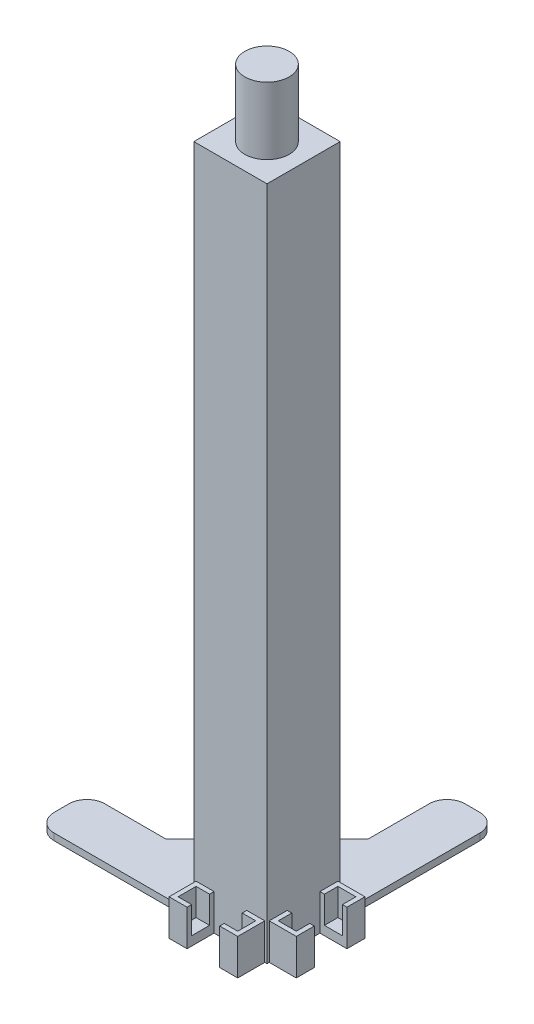
from build123d import *
from build123d.topology import SkipClean

# Parameters (mm, degrees)
SKETCH1_W                = 30
SKETCH1_H                = 30
BOSS_EXTRUDE1_DEPTH      = 80
SKETCH2_R                = 6
BOSS_EXTRUDE2_DEPTH      = 22
CUT_EXTRUDE1_DEPTH       = 83.764726786
BOSS_EXTRUDE3_DEPTH      = 100
BOSS_EXTRUDE5_DEPTH      = 2
BOSS_EXTRUDE6_DEPTH      = 23
BOSS_EXTRUDE7_DEPTH      = 25
FILLET1_R                = 2
SKETCH11_R               = 6.055782361
CUT_EXTRUDE2_DEPTH       = 2.125
SKETCH12_W               = 13.25
SKETCH12_H               = 8.5
CUT_EXTRUDE4_DEPTH       = 13.25
CUT_EXTRUDE5_REACH       = 204.341
SKETCH15_W               = 3.75
SKETCH15_H               = 3.75
FILLET2_R                = 1
CUT_EXTRUDE7_START       = 22
SKETCH16_R               = 6
CUT_EXTRUDE7_DEPTH       = 22
SKETCH17_R               = 15
BOSS_EXTRUDE8_DEPTH      = 40
FILLET3_R                = 1
SKETCH18_R               = 15
SKETCH18_R_2             = 7.5
BOSS_EXTRUDE9_DEPTH      = 2
SKETCH22_R               = 209.016423622
CUT_EXTRUDE8_DEPTH       = 225.815151847
SKETCH23_W               = 22.070362909
SKETCH23_H               = 16.212180161
CUT_EXTRUDE9_DEPTH       = 65.514197169
SKETCH24_R               = 15
BOSS_EXTRUDE10_DEPTH     = 40
SKETCH25_R               = 15
SKETCH25_R_2             = 7.5
BOSS_EXTRUDE11_DEPTH     = 2
BOSS_EXTRUDE12_DEPTH     = 40
SKETCH29_R               = 2
CUT_EXTRUDE10_DEPTH      = 209.128716183
SKETCH30_R               = 3.025
CUT_EXTRUDE11_DEPTH      = 2.1
CUT_EXTRUDE12_DEPTH      = 111.386253673
CUT_EXTRUDE12_DEPTH_BACK = 111.386253673
SKETCH31_W               = 80
SKETCH31_H               = 80
BOSS_EXTRUDE13_DEPTH     = 190
CUT_EXTRUDE13_DEPTH      = 191.213565988
CUT_EXTRUDE13_DEPTH_BACK = 191.213565988
SKETCH33_W               = 105.751798623
SKETCH33_H               = 51.18837061
SKETCH34_R               = 4.925
BOSS_EXTRUDE14_DEPTH     = 14.9
SKETCH35_W               = 6
SKETCH35_H               = 4
SKETCH35_W_2             = 4
SKETCH35_H_2             = 6
BOSS_EXTRUDE15_DEPTH     = 8
SKETCH36_W               = 13.25
SKETCH36_H               = 4
SKETCH36_W_2             = 4
SKETCH36_H_2             = 13.25
CUT_EXTRUDE14_DEPTH      = 6
BOSS_EXTRUDE16_DEPTH     = 1.5
FILLET4_R                = 4


with BuildPart() as part:
    # Sketch1 → Boss-Extrude1 (new body)
    with BuildSketch(Plane(origin=(0, 0, 0), x_dir=(1, 0, 0), z_dir=(0, 1, 0))):
        Rectangle(SKETCH1_W, SKETCH1_H)
    extrude(amount=BOSS_EXTRUDE1_DEPTH)

    # Sketch2 → Boss-Extrude2 (add)
    with BuildSketch(Plane(origin=(0, 80, 0), x_dir=(1, 0, 0), z_dir=(0, 1, 0))):
        with Locations(Location((9, -9, 0), (0, 0, 270))):
            Circle(SKETCH2_R)
    extrude(amount=BOSS_EXTRUDE2_DEPTH)

    # Sketch3 → Cut-Extrude1 (cut, through all)
    with BuildSketch(Plane(origin=(0, 80, 0), x_dir=(1, 0, 0), z_dir=(0, 1, 0))):
        with BuildLine():
            Line((9, -15), (15, -15))
            Line((15, -15), (15, -9))
            ThreePointArc((15, -9), (13.242640687, -13.242640687), (9, -15))
        make_face()
    extrude(amount=-CUT_EXTRUDE1_DEPTH, mode=Mode.SUBTRACT)

    # Sketch4 → Boss-Extrude3 (add)
    with BuildSketch(Plane(origin=(0, 80, 0), x_dir=(1, 0, 0), z_dir=(0, 1, 0))):
        Polygon((-8.25, 11.25), (-8.25, 8.25), (-11.25, 8.25), (-15, 8.25), (-15, 11.25), (-11.25, 11.25), (-11.25, 15), (-8.25, 15), align=None)
        Polygon((-1.75, 1.75), (-11.25, 1.75), (-15, 1.75), (-15, -1.25), (-11.25, -1.25), (1.25, -1.25), (1.25, 11.25), (1.25, 15), (-1.75, 15), (-1.75, 11.25), align=None)
    extrude(amount=BOSS_EXTRUDE3_DEPTH)

    # Sketch6 → Boss-Extrude5 (add)
    with BuildSketch(Plane.XZ):
        with BuildLine():
            Line((15, -15), (7, -15))
            Line((7, -15), (7, -99.5))
            ThreePointArc((7, -99.5), (2.757359313, -109.742640687), (13, -105.5))
            Line((13, -105.5), (15, -105.5))
            Line((15, -105.5), (15, -15))
        make_face()
    extrude(amount=-BOSS_EXTRUDE5_DEPTH)

    # Sketch7 → Boss-Extrude6 (add)
    with SkipClean():  # the faces are left unmerged after this step: merging them gives an invalid solid
        with BuildSketch(Plane(origin=(0, 2, 0), x_dir=(1, 0, 0), z_dir=(0, 1, 0))):
            with BuildLine():
                Line((9, 111.156854249), (9, 108.964101615))
                ThreePointArc((9, 108.964101615), (7, 101.5), (5, 108.964101615))
                Line((5, 108.964101615), (5, 111.156854249))
                ThreePointArc((5, 111.156854249), (1.086408642, 104.485388128), (7, 99.5))
                Line((7, 99.5), (7, 15))
                Line((7, 15), (15, 15))
                Line((15, 15), (15, 105.5))
                Line((15, 105.5), (13, 105.5))
                ThreePointArc((13, 105.5), (11.898979486, 108.964101615), (9, 111.156854249))
            make_face()
        extrude(amount=BOSS_EXTRUDE6_DEPTH)

    # Sketch9 → Boss-Extrude7 (add)
    with SkipClean():  # the faces are left unmerged after this step: merging them gives an invalid solid
        with BuildSketch(Plane.XZ):
            with BuildLine():
                Line((-15, 15), (-15, 7))
                Line((-15, 7), (-126.175, 7))
                ThreePointArc((-126.175, 7), (-126.252697751, 6.037536458), (-126.48377869, 5.1))
                Line((-126.48377869, 5.1), (-128.797778509, 5.1))
                ThreePointArc((-128.797778509, 5.1), (-136.05, 7), (-128.797778509, 8.9))
                Line((-128.797778509, 8.9), (-126.3, 8.9))
                ThreePointArc((-126.3, 8.9), (-128.491885554, 11.955834237), (-132.050001601, 13.173329766))
                Line((-132.050001601, 13.173329766), (-132.050001601, 15))
                Line((-132.050001601, 15), (-15, 15))
            make_face()
        extrude(amount=-BOSS_EXTRUDE7_DEPTH)

    # Fillet1
    fillet1_edges = [part.edges().sort_by_distance(p)[0] for p in [
        (-126.175, 12.5, 7),
    ]]
    fillet(fillet1_edges, radius=FILLET1_R)

    # Sketch11 → Cut-Extrude2 (cut)
    with SkipClean():  # the faces are left unmerged after this step: merging them gives an invalid solid
        with BuildSketch(Plane.XZ):
            with Locations((-132.175, 7)):
                Circle(SKETCH11_R)
        extrude(amount=-CUT_EXTRUDE2_DEPTH, mode=Mode.SUBTRACT)

    # Sketch12 → Cut-Extrude4 (cut)
    with SkipClean():  # the faces are left unmerged after this step: merging them gives an invalid solid
        with BuildSketch(Plane.ZY.offset(15)):
            with Locations((-8.375, 72.75)):
                Rectangle(SKETCH12_W, SKETCH12_H)
        extrude(amount=-CUT_EXTRUDE4_DEPTH, mode=Mode.SUBTRACT)

    # Sketch15 → Cut-Extrude5 (cut, up to next)
    with BuildSketch(Plane(origin=(0, 80, 0), x_dir=(1, 0, 0), z_dir=(0, 1, 0)), mode=Mode.PRIVATE) as cut_extrude5_sk1:
        with Locations((-13.125, 13.125)):
            Rectangle(SKETCH15_W, SKETCH15_H)
    cut_extrude5_tool1 = extrude(cut_extrude5_sk1.sketch, amount=-CUT_EXTRUDE5_REACH, mode=Mode.PRIVATE) & part.part
    add(cut_extrude5_tool1.solids().sort_by_distance((-13.125, 80, -13.125))[0], mode=Mode.SUBTRACT)

    # Fillet2
    fillet2_edges = [part.edges().sort_by_distance(p)[0] for p in [
        (-11.25, 130, -15),
        (-11.25, 130, -11.25),
        (-15, 130, -11.25),
        (-15, 130, 1.25),
        (1.25, 130, -15),
    ]]
    fillet(fillet2_edges, radius=FILLET2_R)

    # Sketch16 → Cut-Extrude7 (cut)
    with SkipClean():  # the faces are left unmerged after this step: merging them gives an invalid solid
        with BuildSketch(Plane(origin=(0, 80, 0), x_dir=(1, 0, 0), z_dir=(0, 1, 0)).offset(CUT_EXTRUDE7_START)):
            with Locations((9, -9)):
                Circle(SKETCH16_R)
        extrude(amount=-CUT_EXTRUDE7_DEPTH, mode=Mode.SUBTRACT)


with BuildPart() as cut_extrude7_kept_piece:
    # of the separate pieces the step leaves, the one the design keeps (cut_extrude7_pieces_kept)
    add(part.part.solids().sort_by_distance((-15, 80, 0.25))[0])

    # Sketch17 → Boss-Extrude8 (add)
    with SkipClean():  # the faces are left unmerged after this step: merging them gives an invalid solid
        with BuildSketch(Plane(origin=(0, 180, 0), x_dir=(1, 0, 0), z_dir=(0, 1, 0))):
            with BuildLine():
                Line((-14, -1.25), (-14, -4.216394713))
                ThreePointArc((-14, -4.216394713), (-14.384018227, -33.129332993), (11.657578086, -20.561885701))
                ThreePointArc((11.657578086, -20.561885701), (14.532144442, -14.532144442), (20.561885701, -11.657578086))
                ThreePointArc((20.561885701, -11.657578086), (33.129332993, 14.384018227), (4.216394713, 14))
                Line((4.216394713, 14), (1.25, 14))
                Line((1.25, 14), (1.25, -1.25))
                Line((1.25, -1.25), (-14, -1.25))
            make_face()
            with Locations(Location((18.79163056, 5.25, 0), (0, 0, 270))):
                Circle(SKETCH17_R, mode=Mode.SUBTRACT)
            with Locations(Location((-5.25, -18.79163056, 0), (0, 0, 270))):
                Circle(SKETCH17_R, mode=Mode.SUBTRACT)
        extrude(amount=-BOSS_EXTRUDE8_DEPTH)

    # Fillet3
    # the kernel refuses this fillet: 1 mm, written as the material it adds along each edge
    with BuildSketch(Plane(origin=(-14, 140, 1.25), x_dir=(-0.9659258262890684, 0, -0.25881904510252046), z_dir=(0, 1, 0))) as fillet3_piece_1:
        with BuildLine():
            CenterArc((0.776457135, 0.965925826), FILLET3_R, 195, 60)
            Line((-0.189468691, 0.707106781), (0, 0))
            ThreePointArc((0, 0), (0.258819045, 0.034074174), (0.51763809, 0))
        make_face()
    extrude(amount=40)
    with BuildSketch(Plane(origin=(-14, 180, 4.216394713), x_dir=(0, 0, -1), z_dir=(0, -1, 0))) as fillet3_piece_2:
        with BuildLine():
            CenterArc((0.555444904, -1), FILLET3_R, 90, 57.202831704)
            ThreePointArc((-0.285148471, -0.458333333), (-0.140754957, -0.230298516), (0, 0))
            Line((0, 0), (0.555444904, 0))
        make_face()
    extrude(amount=40)
    with BuildSketch(Plane(origin=(1.25, 140, -14), x_dir=(-0.2588190451025201, 0, -0.9659258262890685), z_dir=(0, 1, 0))) as fillet3_piece_3:
        with BuildLine():
            CenterArc((0.776457135, -0.965925826), FILLET3_R, 105, 60)
            Line((-0.189468691, -0.707106781), (0, 0))
            ThreePointArc((0, 0), (0.258819045, -0.034074174), (0.51763809, 0))
        make_face()
    extrude(amount=40)
    with BuildSketch(Plane(origin=(4.216394713, 180, -14), x_dir=(-1, 0, 0), z_dir=(0, -1, 0))) as fillet3_piece_4:
        with BuildLine():
            CenterArc((0.555444904, 1), FILLET3_R, 212.797168296, 57.202831704)
            ThreePointArc((-0.285148471, 0.458333333), (-0.140754957, 0.230298516), (0, 0))
            Line((0, 0), (0.555444904, 0))
        make_face()
    extrude(amount=40)

    # Sketch18 → Boss-Extrude9 (add)
    with SkipClean():  # the faces are left unmerged after this step: merging them gives an invalid solid
        with BuildSketch(Plane.XZ.offset(-140)):
            with Locations(Location((-5.25, 18.79163056, 0), (0, 0, 90))):
                Circle(SKETCH18_R)
            with Locations(Location((-5.25, 18.79163056, 0), (0, 0, 270))):
                Circle(SKETCH18_R_2, mode=Mode.SUBTRACT)
        boss_extrude9 = extrude(amount=-BOSS_EXTRUDE9_DEPTH)

    # Sketch21 → Revolve1 (revolve)
    with SkipClean():  # the faces are left unmerged after this step: merging them gives an invalid solid
        with BuildSketch(Plane(origin=(-5.25, 0, 0), x_dir=(0, 0, -1), z_dir=(-1, 0, 0)), mode=Mode.PRIVATE) as revolve1_sk:
            Polygon((-11.29163056, -142), (-3.79163056, -154.5), (-3.79163056, -142), align=None)
        revolve1 = revolve(revolve1_sk.sketch.rotate(Axis((-5.25, 1065, 18.79163056), (0, -1, 0)), 180), axis=Axis((-5.25, 1065, 18.79163056), (0, -1, 0)))

    # Mirror1: Boss-Extrude9, Revolve1 across plane
    with SkipClean():  # the faces are left unmerged after this step: merging them gives an invalid solid
        add(boss_extrude9.mirror(Plane(origin=(0, 0, 0), x_dir=(0.7071067811865478, 0, 0.7071067811865472), z_dir=(0.7071067811865475, 0, -0.7071067811865477))))
        add(revolve1.mirror(Plane(origin=(0, 0, 0), x_dir=(0.7071067811865478, 0, 0.7071067811865472), z_dir=(0.7071067811865475, 0, -0.7071067811865477))))

    # Sketch22 → Cut-Extrude8 (cut, through all)
    with BuildSketch(Plane.XZ.offset(-140)):
        Circle(SKETCH22_R)
    extrude(amount=CUT_EXTRUDE8_DEPTH, mode=Mode.SUBTRACT)


with BuildPart() as cut_extrude8_piece_1:
    # of the separate pieces the step leaves, piece 1, a body of its own (cut_extrude8_pieces)
    add(cut_extrude7_kept_piece.part.solids().sort_by_distance((4.501543184, 180, -14.458333333))[0])

    # Sketch24 → Boss-Extrude10 (add)
    with BuildSketch(Plane(origin=(0, 180, 0), x_dir=(1, 0, 0), z_dir=(0, 1, 0))):
        with BuildLine():
            ThreePointArc((13.834213525, -37.57835306), (39.612293374, -39.612293374), (37.57835306, -13.834213525))
            ThreePointArc((37.57835306, -13.834213525), (33.79372713, -8.329895406), (34.31915027, -1.67070312))
            ThreePointArc((34.31915027, -1.67070312), (28.778505526, -8.507264569), (20.561885701, -11.657578086))
            ThreePointArc((20.561885701, -11.657578086), (14.532144442, -14.532144442), (11.657578086, -20.561885701))
            ThreePointArc((11.657578086, -20.561885701), (8.507264569, -28.778505526), (1.67070312, -34.31915027))
            ThreePointArc((1.67070312, -34.31915027), (8.329895406, -33.79372713), (13.834213525, -37.57835306))
        make_face()
        with Locations(Location((27.591478094, -27.591478094, 0), (0, 0, 270))):
            Circle(SKETCH24_R, mode=Mode.SUBTRACT)
    extrude(amount=-BOSS_EXTRUDE10_DEPTH)

    # Sketch25 → Boss-Extrude11 (add)
    with BuildSketch(Plane.XZ.offset(-140)):
        with Locations(Location((27.591478094, 27.591478094, 0), (0, 0, 90))):
            Circle(SKETCH25_R)
        with Locations(Location((27.591478094, 27.591478094, 0), (0, 0, 270))):
            Circle(SKETCH25_R_2, mode=Mode.SUBTRACT)
    extrude(amount=-BOSS_EXTRUDE11_DEPTH)

    # Sketch26 → Revolve2 (revolve)
    with BuildSketch(Plane(origin=(0, 0, 0), x_dir=(-0.7071067811865476, 0, -0.7071067811865475), z_dir=(0.7071067811865475, 0, -0.7071067811865476)), mode=Mode.PRIVATE) as revolve2_sk:
        Polygon((-24.020242526, 142), (-24.020242526, 154.5), (-31.520242526, 142), align=None)
    revolve(revolve2_sk.sketch.rotate(Axis((27.591478094, 126.995387654, 27.591478094), (0, 1, 0)), 135), axis=Axis((27.591478094, 126.995387654, 27.591478094), (0, 1, 0)))

    # Sketch27 → Boss-Extrude12 (add)
    with BuildSketch(Plane(origin=(0, 180, 0), x_dir=(1, 0, 0), z_dir=(0, 1, 0))):
        Polygon((2.25, -2.25), (2.25, 72.75), (-1.75, 72.75), (-1.75, 1.75), (-72.75, 1.75), (-72.75, -2.25), align=None)
    extrude(amount=-BOSS_EXTRUDE12_DEPTH)

    # Sketch29 → Cut-Extrude10 (cut, through all)
    with BuildSketch(Plane.XY.offset(2.25)):
        with Locations((-24, 144)):
            Circle(SKETCH29_R)
        with Locations((-24, 176)):
            Circle(SKETCH29_R)
        with Locations((-68.75, 144)):
            Circle(SKETCH29_R)
        with Locations((-68.75, 176)):
            Circle(SKETCH29_R)
    cut_extrude10 = extrude(amount=-CUT_EXTRUDE10_DEPTH, mode=Mode.SUBTRACT)

    # Sketch30 → Cut-Extrude11 (cut)
    with BuildSketch(Plane(origin=(0, 0, -1.75), x_dir=(-1, 0, 0), z_dir=(0, 0, -1))):
        with Locations((14.135, 148)):
            Circle(SKETCH30_R)
        with Locations((29.545, 148)):
            Circle(SKETCH30_R)
        with Locations((44.955, 148)):
            Circle(SKETCH30_R)
        with Locations((60.365, 148)):
            Circle(SKETCH30_R)
        with Locations(Location((60.365, 172, 0), (0, 0, 180))):
            Circle(SKETCH30_R)
        with Locations(Location((44.955, 172, 0), (0, 0, 180))):
            Circle(SKETCH30_R)
        with Locations(Location((29.545, 172, 0), (0, 0, 180))):
            Circle(SKETCH30_R)
        with Locations(Location((14.135, 172, 0), (0, 0, 180))):
            Circle(SKETCH30_R)
    cut_extrude11 = extrude(amount=-CUT_EXTRUDE11_DEPTH, mode=Mode.SUBTRACT)

    # Mirror2: Cut-Extrude10, Cut-Extrude11 across plane
    add(cut_extrude10.mirror(Plane(origin=(0, 0, 0), x_dir=(0.7071067811865476, 0, 0.7071067811865475), z_dir=(0.7071067811865475, 0, -0.7071067811865476))), mode=Mode.SUBTRACT)
    add(cut_extrude11.mirror(Plane(origin=(0, 0, 0), x_dir=(0.7071067811865476, 0, 0.7071067811865475), z_dir=(0.7071067811865475, 0, -0.7071067811865476))), mode=Mode.SUBTRACT)

    # Sketch31 → Cut-Extrude12 (cut, two sides: drawn at the far end of the back side and taken through both)
    with BuildSketch(Plane(origin=(0, 180, 0), x_dir=(1, 0, 0), z_dir=(0, 1, 0)).offset(-CUT_EXTRUDE12_DEPTH_BACK)):
        with Locations((-37.75, 37.75)):
            Rectangle(SKETCH31_W, SKETCH31_H)
    extrude(amount=CUT_EXTRUDE12_DEPTH + CUT_EXTRUDE12_DEPTH_BACK, mode=Mode.SUBTRACT)

    # Sketch32 → Boss-Extrude13 (add)
    with BuildSketch(Plane(origin=(0, 180, 0), x_dir=(1, 0, 0), z_dir=(0, 1, 0))):
        with BuildLine():
            Line((-14, -2.25), (2.25, -2.25))
            Line((2.25, -2.25), (2.25, 14))
            Line((2.25, 14), (-9, 14))
            ThreePointArc((-9, 14), (-12.535533906, 12.535533906), (-14, 9))
            Line((-14, 9), (-14, -2.25))
        make_face()
    extrude(amount=-BOSS_EXTRUDE13_DEPTH)

    # Sketch33 → Cut-Extrude13 (cut, two sides: drawn at the far end of the back side and taken through both)
    with BuildSketch(Plane.XY.offset(2.25).offset(-CUT_EXTRUDE13_DEPTH_BACK)):
        with Locations((16.795834719, 165.594185305)):
            Rectangle(SKETCH33_W, SKETCH33_H)
    extrude(amount=CUT_EXTRUDE13_DEPTH + CUT_EXTRUDE13_DEPTH_BACK, mode=Mode.SUBTRACT)

    # Sketch34 → Boss-Extrude14 (add)
    with BuildSketch(Plane(origin=(0, 140, 0), x_dir=(1, 0, 0), z_dir=(0, 1, 0))):
        with Locations(Location((-5.875, 5.875, 0), (0, 0, 270))):
            Circle(SKETCH34_R)
    extrude(amount=BOSS_EXTRUDE14_DEPTH)

    # Sketch35 → Boss-Extrude15 (add)
    with BuildSketch(Plane.XZ.offset(10)):
        with Locations((5.25, -11.5)):
            Rectangle(SKETCH35_W, SKETCH35_H)
        with Locations((5.25, -0.25)):
            Rectangle(SKETCH35_W, SKETCH35_H)
        with Locations((-11.5, 5.25)):
            Rectangle(SKETCH35_W_2, SKETCH35_H_2)
        with Locations((-0.25, 5.25)):
            Rectangle(SKETCH35_W_2, SKETCH35_H_2)
    extrude(amount=-BOSS_EXTRUDE15_DEPTH)

    # Sketch36 → Cut-Extrude14 (cut)
    with BuildSketch(Plane(origin=(0, -2, 0), x_dir=(1, 0, 0), z_dir=(0, 1, 0))):
        with Locations((-5.875, -5.25)):
            Rectangle(SKETCH36_W, SKETCH36_H)
        with Locations((5.25, 5.875)):
            Rectangle(SKETCH36_W_2, SKETCH36_H_2)
    extrude(amount=-CUT_EXTRUDE14_DEPTH, mode=Mode.SUBTRACT)


with BuildPart() as cut_extrude8_piece_2:
    # of the separate pieces the step leaves, piece 2, a body of its own (cut_extrude8_pieces)
    add(cut_extrude7_kept_piece.part.solids().sort_by_distance((-10.25, 140, -15))[0])

    # Sketch23 → Cut-Extrude9 (cut, through all)
    with BuildSketch(Plane(origin=(0, 180, 0), x_dir=(1, 0, 0), z_dir=(0, 1, 0))):
        with Locations((-15.719387653, 13.178118111)):
            Rectangle(SKETCH23_W, SKETCH23_H)
    extrude(amount=-CUT_EXTRUDE9_DEPTH, mode=Mode.SUBTRACT)


with BuildPart() as body_2:
    # Sketch37 → Boss-Extrude16 (new body)
    with BuildSketch(Plane.XZ.offset(10)):
        with BuildLine():
            Line((-9, -14), (2.25, -14))
            Line((2.25, -14), (2.25, -49))
            Line((2.25, -49), (-9, -49))
            Line((-9, -49), (-9, -31.5))
            Line((-9, -31.5), (-31.5, -9))
            Line((-31.5, -9), (-49, -9))
            Line((-49, -9), (-49, 2.25))
            Line((-49, 2.25), (-14, 2.25))
            Line((-14, 2.25), (-14, -9))
            ThreePointArc((-14, -9), (-12.535533906, -12.535533906), (-9, -14))
        make_face()
    extrude(amount=-BOSS_EXTRUDE16_DEPTH)

    # Fillet4
    fillet4_edges = [body_2.edges().sort_by_distance(p)[0] for p in [
        (2.25, -9.25, -49),
        (-9, -9.25, -49),
        (-49, -9.25, -9),
        (-49, -9.25, 2.25),
    ]]
    fillet(fillet4_edges, radius=FILLET4_R)


solid = Compound([cut_extrude8_piece_1.part, body_2.part])
